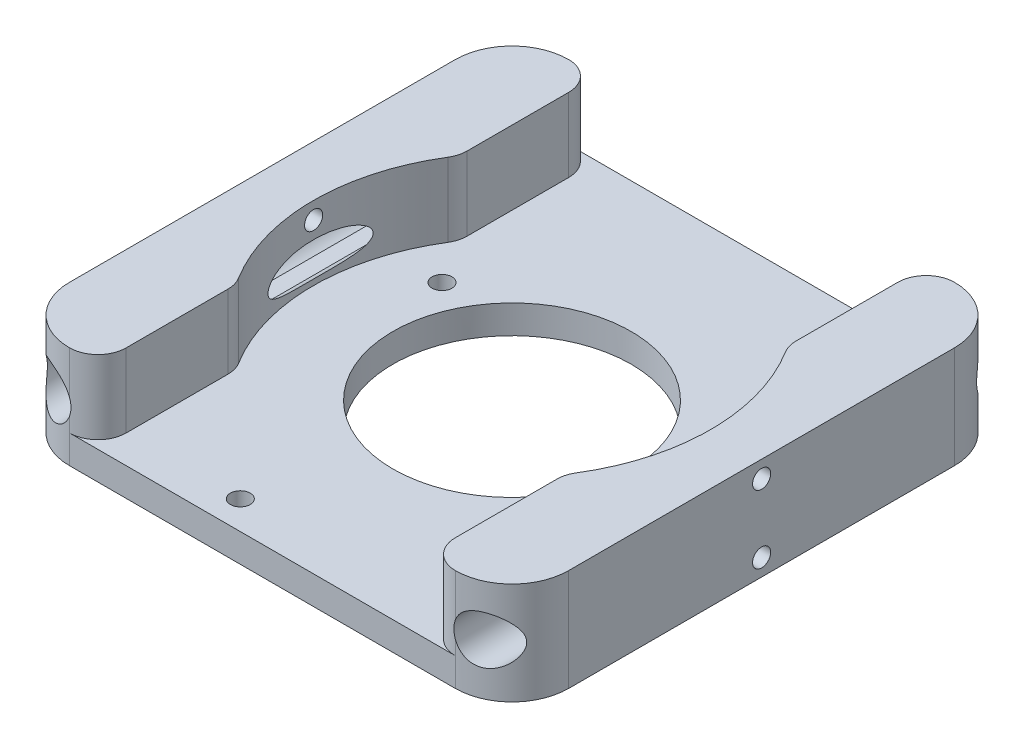
from build123d import *

# Parameters (mm, degrees)
BOSS_EXTRUDE1_DEPTH     = 18
SKETCH2_R               = 4.250000000000005
CUT_EXTRUDE1_DEPTH      = 101.0199980003999
FILLET1_R               = 10
SKETCH3_R               = 35.00000000000001
CUT_EXTRUDE2_DEPTH      = 65.77653912644608
BOSS_EXTRUDE2_START     = 5
SKETCH5_R               = 43.99999999999999
SKETCH5_R_2             = 35.00000000000001
BOSS_EXTRUDE2_DEPTH     = 5
SKETCH8_W               = 58
SKETCH8_H               = 92
CUT_EXTRUDE4_DEPTH      = 13
FILLET2_R               = 5
CUT_EXTRUDE6_REACH      = 102.02
CUT_EXTRUDE6_END_RADIUS = 35.00000000000001
SKETCH12_R              = 1.6000000000000008
SKETCH12_R_2            = 1.6000000000000003
SKETCH15_R              = 35.00000000000001
SKETCH15_R_2            = 1.7499999999999998
SKETCH15_R_3            = 1.7500000000000004
BOSS_EXTRUDE3_DEPTH     = 5
SKETCH16_R              = 1.7500000000000013
CUT_EXTRUDE7_DEPTH      = 64.56886046013409
SKETCH17_R              = 21
CUT_EXTRUDE8_DEPTH      = 10


with BuildPart() as part:
    # Sketch1 → Boss-Extrude1 (new body)
    with BuildSketch(Plane(origin=(0, 0, 0), x_dir=(1, 0, 0), z_dir=(0, 1, 0))):
        Polygon((-44, -44), (43.99999999999999, -44), (43.99999999999999, 44), (-43.99999999999999, 44), align=None)
    extrude(amount=BOSS_EXTRUDE1_DEPTH)

    # Sketch2 → Cut-Extrude1 (cut, through all)
    with BuildSketch(Plane.XY.offset(44)):
        with Locations((-38, 9)):
            Circle(SKETCH2_R)
        with Locations(Location((38, 9, 0), (0, 0, 180))):
            Circle(SKETCH2_R)
    extrude(amount=-CUT_EXTRUDE1_DEPTH, mode=Mode.SUBTRACT)

    # Fillet1
    # the kernel refuses this fillet: 10 mm, written as the material it takes off along each edge
    with BuildSketch(Plane(origin=(44, -25, 44), x_dir=(-1, 0, 0), z_dir=(0, 1, 0)), Plane(origin=(43.99999999999999, -25, -44), x_dir=(0, 0, 1), z_dir=(0, 1, 0))) as fillet1_piece_1:
        with BuildLine():
            CenterArc((FILLET1_R, -FILLET1_R), FILLET1_R, 90, 90)
            Line((0, -FILLET1_R), (0, 0))
            Line((0, 0), (FILLET1_R, 0))
        make_face()
    extrude(amount=68, mode=Mode.SUBTRACT)
    with BuildSketch(Plane(origin=(-44, -25, 44), x_dir=(1, 0, 0), z_dir=(0, 1, 0)), Plane(origin=(-43.99999999999999, -25, -44), x_dir=(0, 0, 1), z_dir=(0, 1, 0))) as fillet1_piece_2:
        with BuildLine():
            CenterArc((FILLET1_R, FILLET1_R), FILLET1_R, 180, 90)
            Line((0, FILLET1_R), (0, 0))
            Line((0, 0), (FILLET1_R, 0))
        make_face()
    extrude(amount=68, mode=Mode.SUBTRACT)

    # Sketch3 → Cut-Extrude2 (cut, through all)
    with BuildSketch(Plane(origin=(0, 18, 0), x_dir=(1, 0, 0), z_dir=(0, 1, 0))):
        with Locations(Location((0, 0, 0), (0, 0, 270))):
            Circle(SKETCH3_R)
    extrude(amount=-CUT_EXTRUDE2_DEPTH, mode=Mode.SUBTRACT)

    # Sketch5 → Boss-Extrude2 (add)
    with BuildSketch(Plane(origin=(0, 0, 0), x_dir=(1, 0, 0), z_dir=(0, 1, 0)).offset(BOSS_EXTRUDE2_START)):
        Circle(SKETCH5_R)
        with Locations(Location((0, 0, 0), (0, 0, 270))):
            Circle(SKETCH5_R_2, mode=Mode.SUBTRACT)
    extrude(amount=-BOSS_EXTRUDE2_DEPTH)

    # Sketch8 → Cut-Extrude4 (cut)
    with BuildSketch(Plane(origin=(0, 18, 0), x_dir=(1, 0, 0), z_dir=(0, 1, 0))):
        Rectangle(SKETCH8_W, SKETCH8_H)
    extrude(amount=-CUT_EXTRUDE4_DEPTH, mode=Mode.SUBTRACT)

    # Fillet2
    # the kernel refuses this fillet: 5 mm, written as the material it takes off along each edge
    with BuildSketch(Plane(origin=(29, 30.5, 44), x_dir=(1, 0, 0), z_dir=(0, -1, 0)), Plane(origin=(-29.000000000000007, 30.5, -44), x_dir=(-1, 0, 0), z_dir=(0, -1, 0))) as fillet2_piece_1:
        with BuildLine():
            CenterArc((FILLET2_R, -FILLET2_R), FILLET2_R, 90, 90)
            Line((0, -FILLET2_R), (0, 0))
            Line((0, 0), (FILLET2_R, 0))
        make_face()
    extrude(amount=25.5, mode=Mode.SUBTRACT)
    with BuildSketch(Plane(origin=(28.999999999999996, 5, 19.59591794226544), x_dir=(0.5434386589178635, 0, -0.8394488811080482), z_dir=(0, 1, 0))) as fillet2_piece_2:
        with BuildLine():
            CenterArc((1.4786791763610776, -4.999028131277516), FILLET2_R, 91.12970087647003, 31.78833061705157)
            Line((-1.2385141182282366, -0.8017837257372739), (0, 0))
            ThreePointArc((0, 0), (0.6900502823018299, -0.00680308105738167), (1.380100564603668, -4e-17))
        make_face()
    extrude(amount=16.688473908600116, mode=Mode.SUBTRACT)
    with BuildSketch(Plane(origin=(28.999999999999996, 5, -19.59591794226544), x_dir=(2.41e-15, 0, -1), z_dir=(0, 1, 0))) as fillet2_piece_3:
        with BuildLine():
            CenterArc((1.475389563440055, -5), FILLET2_R, 90.00000000000014, 31.788330617051614)
            ThreePointArc((-1.15852387477314, -0.7500000000000063), (-0.5755648801402335, -0.38071083878170736), (0, 0))
            Line((0, 0), (1.475389563440043, 0))
        make_face()
    extrude(amount=16.688473908600105, mode=Mode.SUBTRACT)
    with BuildSketch(Plane(origin=(28.999999999999996, 5, -44), x_dir=(1, 0, 0), z_dir=(0, 1, 0))) as fillet2_piece_4:
        with BuildLine():
            CenterArc((FILLET2_R, -FILLET2_R), FILLET2_R, 90, 89.99999999999991)
            Line((-3.55e-15, -FILLET2_R), (0, 0))
            Line((0, 0), (FILLET2_R, 0))
        make_face()
    extrude(amount=25.49999999999999, mode=Mode.SUBTRACT)
    with BuildSketch(Plane(origin=(-29.000000000000004, 5, -19.59591794226543), x_dir=(2.41e-15, 0, -1), z_dir=(0, 1, 0))) as fillet2_piece_5:
        with BuildLine():
            CenterArc((1.4753895634400487, 5), FILLET2_R, 238.21166938294837, 31.78833061705177)
            ThreePointArc((-1.1585238747731363, 0.7500000000000008), (-0.575564880140214, 0.3807108387816939), (0, 0))
            Line((0, 0), (1.4753895634400607, 0))
        make_face()
    extrude(amount=16.68847390860015, mode=Mode.SUBTRACT)
    with BuildSketch(Plane(origin=(-29.000000000000004, 5, 19.59591794226543), x_dir=(-0.5434386589178587, 0, -0.8394488811080513), z_dir=(0, 1, 0))) as fillet2_piece_6:
        with BuildLine():
            CenterArc((1.4786791763610454, 4.9990281312775195), FILLET2_R, 237.08196850647857, 31.78833061705177)
            Line((-1.238514118228257, 0.8017837257372686), (0, 0))
            ThreePointArc((0, 0), (0.6900502823018377, 0.00680308105738472), (1.380100564603667, -2e-17))
        make_face()
    extrude(amount=16.68847390860015, mode=Mode.SUBTRACT)
    with BuildSketch(Plane(origin=(-29.000000000000004, 5, 44), x_dir=(-1, 0, 0), z_dir=(0, 1, 0))) as fillet2_piece_7:
        with BuildLine():
            CenterArc((FILLET2_R, -FILLET2_R), FILLET2_R, 90, 90)
            Line((-3.55e-15, -FILLET2_R), (0, 0))
            Line((0, 0), (FILLET2_R, 0))
        make_face()
    extrude(amount=25.5, mode=Mode.SUBTRACT)

    # Cut-Extrude6: up to this cylinder (the profile starts outside it)
    cut_extrude6_end = Plane(origin=(0, 9, 0), z_dir=(0, 1, 0)) * Cylinder(CUT_EXTRUDE6_END_RADIUS, 287.04, mode=Mode.PRIVATE)
    # Sketch12 → Cut-Extrude6 (cut, up to the surface)
    with BuildSketch(Plane(origin=(43.99999999999999, 0, 0), x_dir=(0, 0, -1), z_dir=(1, 0, 0)), mode=Mode.PRIVATE) as cut_extrude6_sk1:
        with Locations((0, 15)):
            Circle(SKETCH12_R)
    cut_extrude6_tool1 = extrude(cut_extrude6_sk1.sketch, amount=-CUT_EXTRUDE6_REACH, mode=Mode.PRIVATE) - cut_extrude6_end
    # Sketch12 → Cut-Extrude6 (cut, up to the surface)
    with BuildSketch(Plane(origin=(43.99999999999999, 0, 0), x_dir=(0, 0, -1), z_dir=(1, 0, 0)), mode=Mode.PRIVATE) as cut_extrude6_sk2:
        with Locations((0, 3.000000000000001)):
            Circle(SKETCH12_R_2)
    cut_extrude6_tool2 = extrude(cut_extrude6_sk2.sketch, amount=-CUT_EXTRUDE6_REACH, mode=Mode.PRIVATE) - cut_extrude6_end
    cut_extrude6 = cut_extrude6_tool1.solids().sort_by_distance((44, 15, 0))[0] + cut_extrude6_tool2.solids().sort_by_distance((44, 3, 0))[0]
    add(cut_extrude6, mode=Mode.SUBTRACT)

    # Mirror1: Cut-Extrude6 across plane
    add(cut_extrude6.mirror(Plane(origin=(0, 0, 0), x_dir=(0, 0, 1), z_dir=(1, 0, 0))), mode=Mode.SUBTRACT)

    # Sketch15 → Boss-Extrude3 (add)
    with BuildSketch(Plane(origin=(0, 5, 0), x_dir=(1, 0, 0), z_dir=(0, 1, 0))):
        Circle(SKETCH15_R)
        with Locations(Location((24.13, 13.070000000000011, 0), (0, 0, 270))):
            Circle(SKETCH15_R_2, mode=Mode.SUBTRACT)
        with Locations(Location((-24.130000000000006, 11.800000000000004, 0), (0, 0, 270))):
            Circle(SKETCH15_R_3, mode=Mode.SUBTRACT)
    extrude(amount=-BOSS_EXTRUDE3_DEPTH)

    # Sketch16 → Cut-Extrude7 (cut, through all)
    with BuildSketch(Plane(origin=(0, 5, 0), x_dir=(1, 0, 0), z_dir=(0, 1, 0))):
        with Locations(Location((-8.890000000000006, -38.99999999999999, 0), (0, 0, 270))):
            Circle(SKETCH16_R)
    extrude(amount=-CUT_EXTRUDE7_DEPTH, mode=Mode.SUBTRACT)

    # Sketch17 → Cut-Extrude8 (cut)
    with BuildSketch(Plane(origin=(0, 5, 0), x_dir=(1, 0, 0), z_dir=(0, 1, 0))):
        with Locations(Location((2.082e-14, -2.082e-14, 0), (0, 0, 270))):
            Circle(SKETCH17_R)
    extrude(amount=-CUT_EXTRUDE8_DEPTH, mode=Mode.SUBTRACT)


solid = part.part
